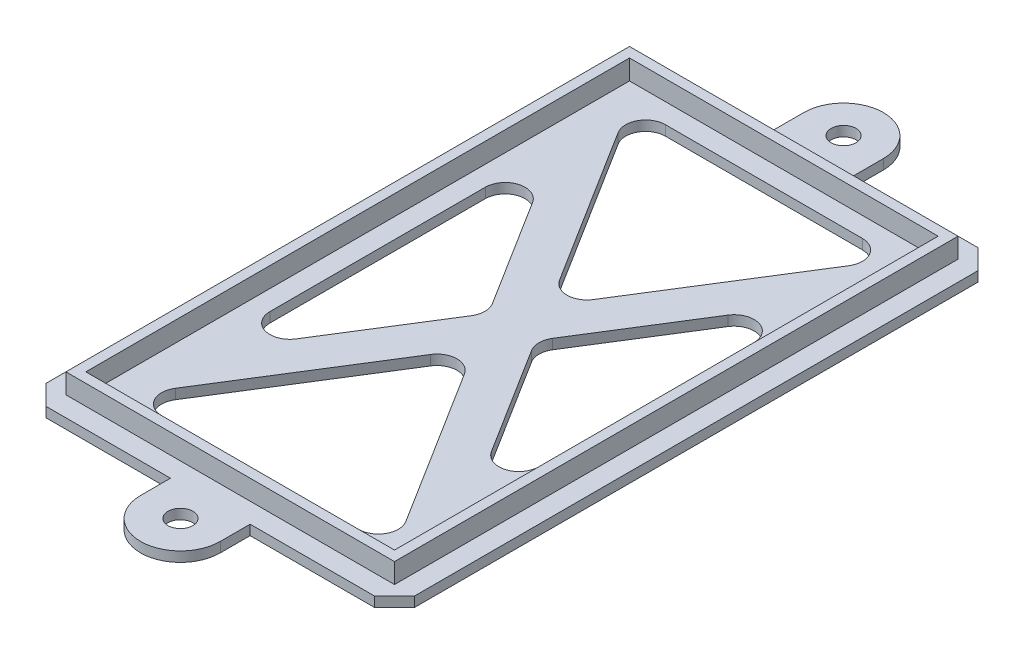
from build123d import *

# Parameters (mm, degrees)
SKETCH1_W           = 41.91
SKETCH1_H           = 71.882
SKETCH1_W_2         = 39.37
SKETCH1_H_2         = 69.342
BOSS_EXTRUDE4_DEPTH = 2.54
SKETCH5_W           = 46.99
SKETCH5_H           = 76.962
BOSS_EXTRUDE5_DEPTH = 1.27
CHAMFER4_SIZE       = 2.54
CUT_EXTRUDE1_DEPTH  = 2.54
FILLET1_R           = 2.54
SKETCH7_R           = 1.5875
BOSS_EXTRUDE6_DEPTH = 1.27


with BuildPart() as part:
    # Sketch1 → Boss-Extrude4 (new body)
    with BuildSketch(Plane(origin=(0, 0, 0), x_dir=(1, 0, 0), z_dir=(0, 1, 0))):
        with Locations((-19.685, -34.671)):
            Rectangle(SKETCH1_W, SKETCH1_H)
        with Locations((-19.685, -34.671)):
            Rectangle(SKETCH1_W_2, SKETCH1_H_2, mode=Mode.SUBTRACT)
    extrude(amount=BOSS_EXTRUDE4_DEPTH)

    # Sketch5 → Boss-Extrude5 (add)
    with BuildSketch(Plane.XZ):
        with Locations((-19.685, 34.671)):
            Rectangle(SKETCH5_W, SKETCH5_H)
    extrude(amount=BOSS_EXTRUDE5_DEPTH)

    # Chamfer4
    chamfer4_edges = [part.edges().sort_by_distance(p)[0] for p in [
        (-43.18, -0.635, 73.152),
        (3.81, -0.635, 73.152),
        (3.81, -0.635, -3.81),
        (-43.18, -0.635, -3.81),
    ]]
    chamfer(chamfer4_edges, length=CHAMFER4_SIZE)

    # Sketch6 → Cut-Extrude1 (cut)
    with BuildSketch(Plane(origin=(0, 0, 0), x_dir=(1, 0, 0), z_dir=(0, 1, 0))):
        Polygon((-36.83, -2.54), (-2.54, -2.54), (-19.685, -29.888964801), align=None)
        Polygon((-36.83, -12.104070398), (-36.83, -57.237929602), (-22.68284632, -34.671), align=None)
        Polygon((-36.83, -66.802), (-2.54, -66.802), (-19.685, -39.453035199), align=None)
        Polygon((-2.54, -12.104070398), (-2.54, -57.237929602), (-16.68715368, -34.671), align=None)
    extrude(amount=-CUT_EXTRUDE1_DEPTH, mode=Mode.SUBTRACT)

    # Fillet1
    fillet1_edges = [part.edges().sort_by_distance(p)[0] for p in [
        (-19.685, -0.635, 39.453035199),
        (-36.83, -0.635, 66.802),
        (-2.54, -0.635, 57.237929602),
        (-2.54, -0.635, 12.104070398),
        (-16.68715368, -0.635, 34.671),
        (-22.68284632, -0.635, 34.671),
        (-19.685, -0.635, 29.888964801),
        (-2.54, -0.635, 2.54),
        (-36.83, -0.635, 12.104070398),
        (-2.54, -0.635, 66.802),
        (-36.83, -0.635, 57.237929602),
        (-36.83, -0.635, 2.54),
    ]]
    fillet(fillet1_edges, radius=FILLET1_R)

    # Sketch7 → Boss-Extrude6 (add)
    # profile 1 of 2: a face of its own
    with BuildSketch(Plane(origin=(0, 0, 0), x_dir=(1, 0, 0), z_dir=(0, 1, 0))):
        with BuildLine():
            Line((-14.605, 7.62), (-14.605, 3.81))
            Line((-14.605, 3.81), (-24.765, 3.81))
            Line((-24.765, 3.81), (-24.765, 7.62))
            ThreePointArc((-24.765, 7.62), (-19.685, 12.7), (-14.605, 7.62))
        make_face()
        with Locations((-19.685, 7.62)):
            Circle(SKETCH7_R, mode=Mode.SUBTRACT)
    # profile 2 of 2: a face of its own
    with BuildSketch(Plane(origin=(0, 0, 0), x_dir=(1, 0, 0), z_dir=(0, 1, 0))):
        with BuildLine():
            Line((-24.765, -73.152), (-24.765, -76.962))
            ThreePointArc((-24.765, -76.962), (-19.685, -82.042), (-14.605, -76.962))
            Line((-14.605, -76.962), (-14.605, -73.152))
            Line((-14.605, -73.152), (-24.765, -73.152))
        make_face()
        with Locations((-19.685, -76.962)):
            Circle(SKETCH7_R, mode=Mode.SUBTRACT)
    extrude(amount=-BOSS_EXTRUDE6_DEPTH)


solid = part.part
